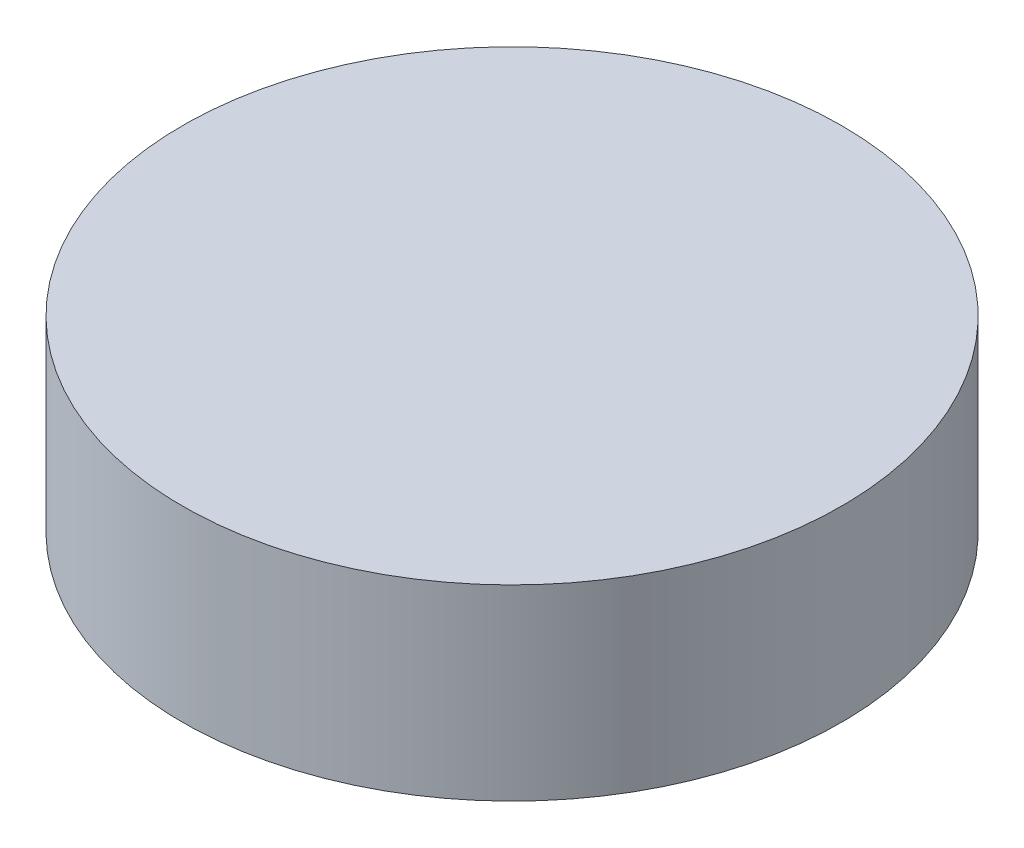
from build123d import *

# Parameters (mm, degrees)
SKETCH1_R           = 268.216999097
BOSS_EXTRUDE1_DEPTH = 152.4


with BuildPart() as part:
    # Sketch1 → Boss-Extrude1 (new body)
    with BuildSketch(Plane(origin=(0, 0, 0), x_dir=(1, 0, 0), z_dir=(0, 1, 0))):
        Circle(SKETCH1_R)
    extrude(amount=BOSS_EXTRUDE1_DEPTH)


solid = part.part
